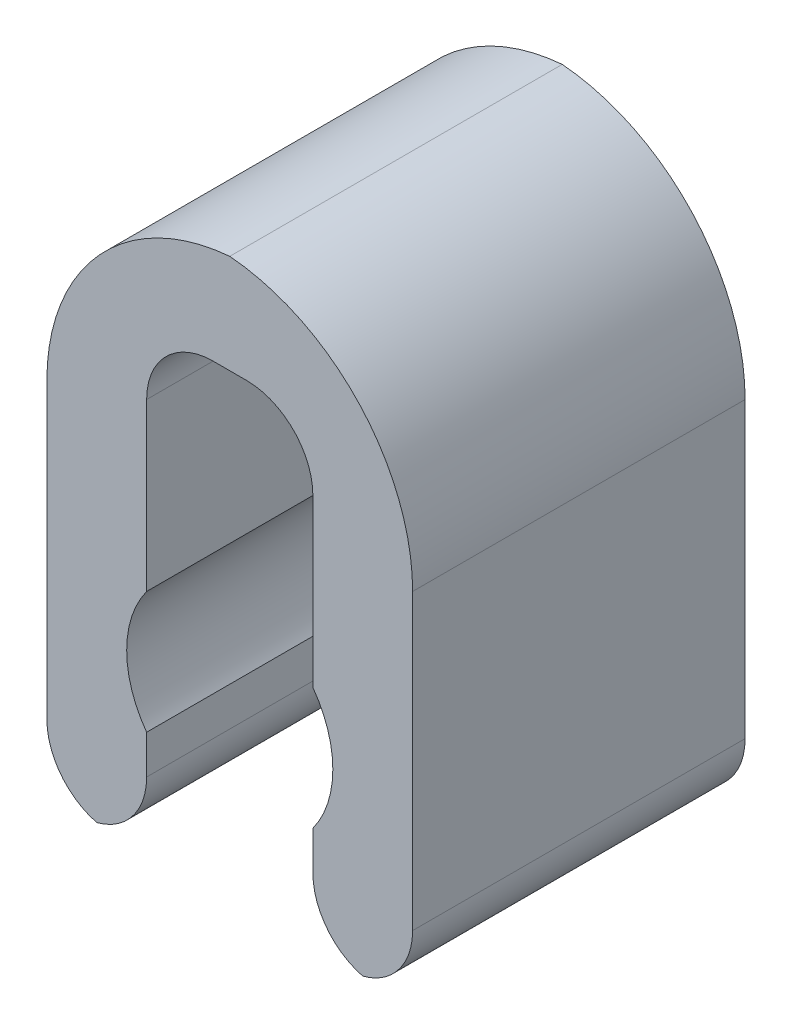
from build123d import *

# Parameters (mm, degrees)
BOSS_EXTRUDE1_DEPTH = 10
FILLET1_R           = 6
FILLET2_R           = 2
FILLET3_R           = 2


with BuildPart() as part:
    # Sketch1 → Boss-Extrude1 (new body)
    with BuildSketch(Plane.XY):
        with BuildLine():
            Line((-27.171188048, -9.347902097), (-27.171188048, -6.180932375))
            ThreePointArc((-27.171188048, -6.180932375), (-27.771188048, -4.347902097), (-27.171188048, -2.514871819))
            Line((-27.171188048, -2.514871819), (-27.171188048, 4.485128181))
            Line((-27.171188048, 4.485128181), (-22.171188048, 4.485128181))
            Line((-22.171188048, 4.485128181), (-22.171188048, -2.514871819))
            ThreePointArc((-22.171188048, -2.514871819), (-21.725004076, -3.38353702), (-21.571188048, -4.347902097))
            ThreePointArc((-21.571188048, -4.347902097), (-21.725004076, -5.312267173), (-22.171188048, -6.180932375))
            Line((-22.171188048, -6.180932375), (-22.171188048, -9.347902097))
            Line((-22.171188048, -9.347902097), (-19.171188048, -9.347902097))
            Line((-19.171188048, -9.347902097), (-19.171188048, 7.485128181))
            Line((-19.171188048, 7.485128181), (-30.171188048, 7.485128181))
            Line((-30.171188048, 7.485128181), (-30.171188048, -9.347902097))
            Line((-30.171188048, -9.347902097), (-27.171188048, -9.347902097))
        make_face()
    extrude(amount=BOSS_EXTRUDE1_DEPTH)

    # Fillet1
    # the kernel refuses this fillet: 6 mm, written as the material it takes off along each edge
    with BuildSketch(Plane(origin=(-19.171188048, 7.485128181, -15), x_dir=(-1, 0, 0), z_dir=(0, 0, 1))) as fillet1_piece_1:
        with BuildLine():
            CenterArc((FILLET1_R, FILLET1_R), FILLET1_R, 180, 90)
            Line((0, FILLET1_R), (0, 0))
            Line((0, 0), (FILLET1_R, 0))
        make_face()
    extrude(amount=40, mode=Mode.SUBTRACT)
    with BuildSketch(Plane(origin=(-30.171188048, 7.485128181, -15), x_dir=(1, 0, 0), z_dir=(0, 0, 1))) as fillet1_piece_2:
        with BuildLine():
            CenterArc((FILLET1_R, -FILLET1_R), FILLET1_R, 90, 90)
            Line((0, -FILLET1_R), (0, 0))
            Line((0, 0), (FILLET1_R, 0))
        make_face()
    extrude(amount=40, mode=Mode.SUBTRACT)

    # Fillet2
    # the kernel refuses this fillet: 2 mm, written as the material it takes off along each edge
    with BuildSketch(Plane(origin=(-19.171188048, -9.347902097, -5), x_dir=(0, 1, 0), z_dir=(0, 0, 1)), Plane(origin=(-22.171188048, -9.347902097, -5), x_dir=(1, 0, 0), z_dir=(0, 0, 1)), Plane(origin=(-30.171188048, -9.347902097, -5), x_dir=(1, 0, 0), z_dir=(0, 0, 1))) as fillet2_piece_1:
        with BuildLine():
            CenterArc((FILLET2_R, FILLET2_R), FILLET2_R, 180, 90)
            Line((0, FILLET2_R), (0, 0))
            Line((0, 0), (FILLET2_R, 0))
        make_face()
    extrude(amount=20, mode=Mode.SUBTRACT)
    with BuildSketch(Plane(origin=(-27.171188048, -9.347902097, -5), x_dir=(-1, 0, 0), z_dir=(0, 0, 1))) as fillet2_piece_2:
        with BuildLine():
            CenterArc((FILLET2_R, -FILLET2_R), FILLET2_R, 90, 90)
            Line((0, -FILLET2_R), (0, 0))
            Line((0, 0), (FILLET2_R, 0))
        make_face()
    extrude(amount=20, mode=Mode.SUBTRACT)

    # Fillet3
    fillet3_edges = [part.edges().sort_by_distance(p)[0] for p in [
        (-22.171188048, 4.485128181, 5),
        (-27.171188048, 4.485128181, 5),
    ]]
    fillet(fillet3_edges, radius=FILLET3_R)


solid = part.part
